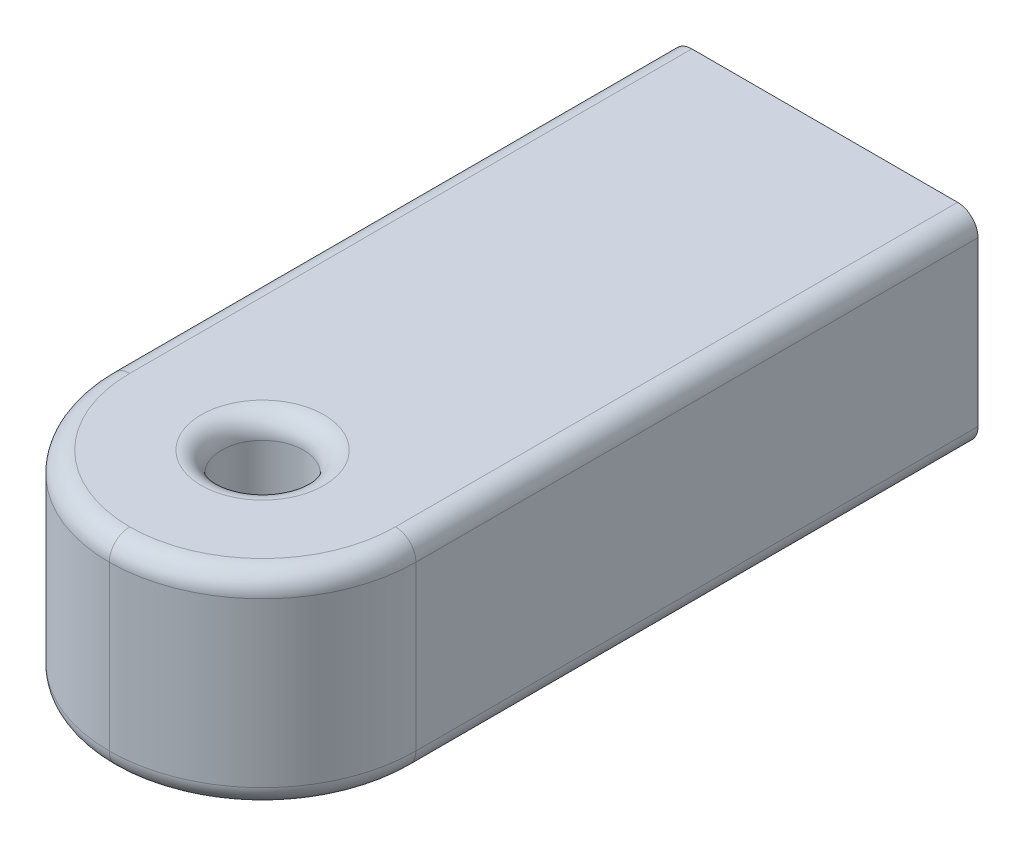
from build123d import *

# Parameters (mm, degrees)
SKETCH1_W               = 15
SKETCH1_H               = 10
BOSS_EXTRUDE1_DEPTH     = 35
FILLET1_R               = 7.5
CUT_EXTRUDE1_DEPTH      = 38.165171868
CUT_EXTRUDE1_DEPTH_BACK = 38.165171868
SKETCH2_R               = 2
FILLET2_R               = 1


with BuildPart() as part:
    # Sketch1 → Boss-Extrude1 (new body)
    with BuildSketch(Plane.XY):
        Rectangle(SKETCH1_W, SKETCH1_H)
    extrude(amount=BOSS_EXTRUDE1_DEPTH)

    # Fillet1
    fillet1_edges = [part.edges().sort_by_distance(p)[0] for p in [
        (7.5, 0, 35),
        (-7.5, 0, 35),
    ]]
    fillet(fillet1_edges, radius=FILLET1_R - 0.0001)  # a hair under: the kernel refuses the full size

    # Sketch2 → Cut-Extrude1 (cut, two sides: drawn at the far end of the back side and taken through both)
    with BuildSketch(Plane(origin=(0, 5, 0), x_dir=(1, 0, 0), z_dir=(0, 1, 0)).offset(-CUT_EXTRUDE1_DEPTH_BACK)):
        with Locations(Location((0, -27.5, 0), (0, 0, 180))):
            Circle(SKETCH2_R)
    extrude(amount=CUT_EXTRUDE1_DEPTH + CUT_EXTRUDE1_DEPTH_BACK, mode=Mode.SUBTRACT)

    # Fillet2
    fillet2_edges = [part.edges().sort_by_distance(p)[0] for p in [
        (7.5, 5, 13.75005),
        (7.5, -5, 13.75005),
        (-7.5, -5, 13.75005),
        (-5.303330148, -5, 32.803330148),
        (5.303330148, -5, 32.803330148),
        (-7.5, 5, 13.75005),
        (-5.303330148, 5, 32.803330148),
        (5.303330148, 5, 32.803330148),
        (2, -5, 27.5),
        (2, 5, 27.5),
    ]]
    fillet(fillet2_edges, radius=FILLET2_R)


solid = part.part
